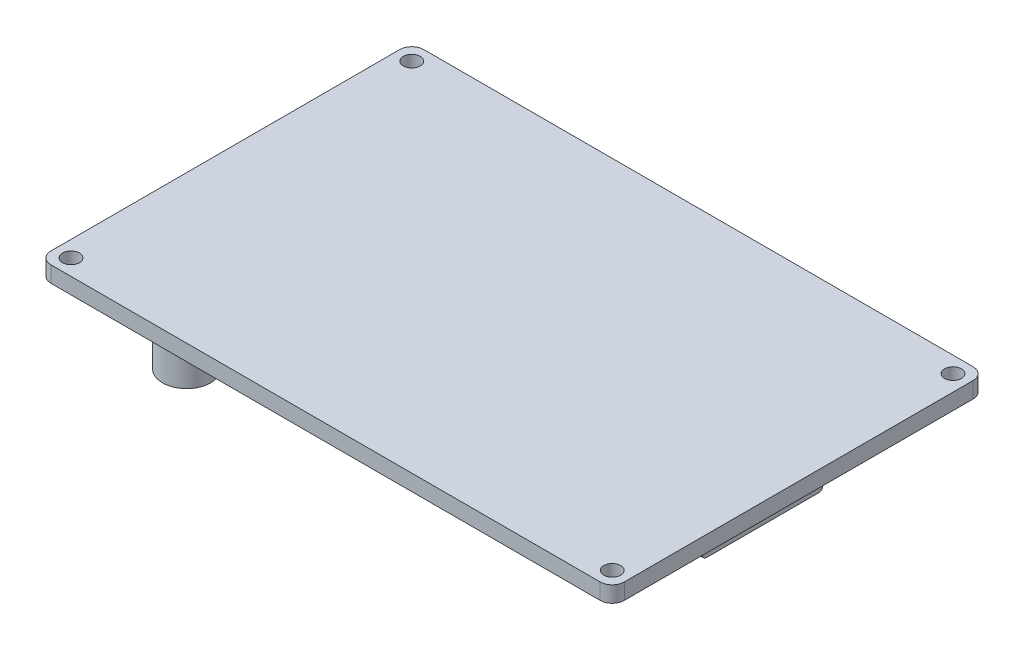
from build123d import *

# Parameters (mm, degrees)
SKETCH1_W               = 143
SKETCH1_H               = 93
LID_BASE_DEPTH          = 4
FILLET1_R               = 3
SKETCH3_W               = 136.2
SKETCH3_H               = 86.2
SKETCH3_W_2             = 127
SKETCH3_H_2             = 77
LIP_DEPTH               = 1.5
SKETCH2_R               = 2.1
SCREWS_DEPTH            = 86.467830205
LIP_FILLET_R            = 2
LIP_CHAMFER_SIZE        = 0.5
SKETCH4_W               = 5
SKETCH4_H               = 2
SKETCH4_W_2             = 2
SKETCH4_H_2             = 30
BATTERY_POCKET_DEPTH    = 14
BOTTOM_POCKET_FILLET_R  = 3
POCKET_CORNER_FILLETS_R = 1
POCKET_CHAMFER_SIZE     = 0.75
SKETCH5_R               = 6
STOMP_SUPPORT_DEPTH     = 18.85
SKETCH6_R               = 3.25
SCREW_HEAD_PLACE_DEPTH  = 4
FILLET4_R               = 1.5


with BuildPart() as part:
    # Sketch1 → lid base (new body)
    with BuildSketch(Plane(origin=(0, 0, 0), x_dir=(1, 0, 0), z_dir=(0, 1, 0))):
        Rectangle(SKETCH1_W, SKETCH1_H)
    extrude(amount=LID_BASE_DEPTH)

    # Fillet1
    fillet1_edges = [part.edges().sort_by_distance(p)[0] for p in [
        (-71.5, 2, -46.5),
        (71.5, 2, -46.5),
        (71.5, 2, 46.5),
        (-71.5, 2, 46.5),
    ]]
    fillet(fillet1_edges, radius=FILLET1_R)

    # Sketch3 → lip (add)
    with BuildSketch(Plane.XZ):
        Rectangle(SKETCH3_W, SKETCH3_H)
        Rectangle(SKETCH3_W_2, SKETCH3_H_2, mode=Mode.SUBTRACT)
    extrude(amount=LIP_DEPTH)

    # Sketch2 → screws (cut, through all)
    with BuildSketch(Plane(origin=(0, 4, 0), x_dir=(1, 0, 0), z_dir=(0, 1, 0))):
        with Locations(Location((-67.5, -42.5, 0), (0, 0, 270))):
            Circle(SKETCH2_R)
        with Locations(Location((67.5, -42.5, 0), (0, 0, 270))):
            Circle(SKETCH2_R)
        with Locations(Location((67.5, 42.5, 0), (0, 0, 270))):
            Circle(SKETCH2_R)
        with Locations(Location((-67.5, 42.5, 0), (0, 0, 270))):
            Circle(SKETCH2_R)
    extrude(amount=-SCREWS_DEPTH, mode=Mode.SUBTRACT)

    # lip fillet
    lip_fillet_edges = [part.edges().sort_by_distance(p)[0] for p in [
        (63.5, -0.75, 38.5),
        (-63.5, -0.75, 38.5),
        (-63.5, -0.75, -38.5),
        (63.5, -0.75, -38.5),
    ]]
    fillet(lip_fillet_edges, radius=LIP_FILLET_R)

    # lip chamfer
    lip_chamfer_edges = [part.edges().sort_by_distance(p)[0] for p in [
        (0, -1.5, 38.5),
        (-63.5, -1.5, 0),
        (0, -1.5, -38.5),
        (63.5, -1.5, 0),
        (-62.914213562, -1.5, 37.914213562),
        (-62.914213562, -1.5, -37.914213562),
        (62.914213562, -1.5, -37.914213562),
        (62.914213562, -1.5, 37.914213562),
        (0, -1.5, -43.1),
        (-68.1, -1.5, 0),
        (0, -1.5, 43.1),
        (68.1, -1.5, 0),
        (-65.816254176, -1.5, -41.24500996),
        (65.816254176, -1.5, -41.24500996),
        (66.01507576, -1.5, 41.01507576),
        (-66.01507576, -1.5, 41.01507576),
    ]]
    chamfer(lip_chamfer_edges, length=LIP_CHAMFER_SIZE)

    # Sketch4 → battery pocket (add)
    with BuildSketch(Plane(origin=(0, 4, 0), x_dir=(1, 0, 0), z_dir=(0, 1, 0))):
        with Locations((47, -27)):
            Rectangle(SKETCH4_W, SKETCH4_H)
        with Locations((61.5, 0)):
            Rectangle(SKETCH4_W_2, SKETCH4_H_2)
        with Locations((32.5, 0)):
            Rectangle(SKETCH4_W_2, SKETCH4_H_2)
        with Locations((47, 27)):
            Rectangle(SKETCH4_W, SKETCH4_H)
    extrude(amount=-BATTERY_POCKET_DEPTH)

    # bottom pocket fillet
    bottom_pocket_fillet_edges = [part.edges().sort_by_distance(p)[0] for p in [
        (44.5, 0, 27),
        (49.5, 0, 27),
        (61.5, 0, 15),
        (61.5, 0, -15),
        (32.5, 0, 15),
        (32.5, 0, -15),
        (49.5, 0, -27),
        (44.5, 0, -27),
    ]]
    fillet(bottom_pocket_fillet_edges, radius=BOTTOM_POCKET_FILLET_R)

    # pocket corner fillets
    pocket_corner_fillets_edges = [part.edges().sort_by_distance(p)[0] for p in [
        (49.5, -10, 27),
        (44.5, -10, 27),
        (61.5, -10, -15),
        (61.5, -10, 15),
        (32.5, -10, -15),
        (32.5, -10, 15),
        (44.5, -10, -27),
        (49.5, -10, -27),
    ]]
    fillet(pocket_corner_fillets_edges, radius=POCKET_CORNER_FILLETS_R)

    # pocket chamfer
    # the kernel refuses this chamfer: 0.75 mm, written as the material it takes off along each edge
    with BuildSketch(Plane(origin=(41.5, -3, 26), x_dir=(-0.5997422926450471, 0.8001932156753535, 0), z_dir=(-0.8001932156753535, -0.5997422926450471, 0))) as pocket_chamfer_piece_1_section:
        Polygon((3, -POCKET_CHAMFER_SIZE), (3 + POCKET_CHAMFER_SIZE, 0), (3, 0), align=None)
    pocket_chamfer_piece_1 = revolve(axis=Axis((41.5, -3, 26), (0, 0, -1)), revolution_arc=126.851442945, mode=Mode.PRIVATE)
    pocket_chamfer_piece_1 = split(pocket_chamfer_piece_1, bisect_by=Plane(origin=(43.677166172, 0, 26.274961133), z_dir=(0, -1, 0)), keep=Keep.TOP, mode=Mode.PRIVATE)
    add(pocket_chamfer_piece_1, mode=Mode.SUBTRACT)
    with BuildSketch(Plane(origin=(52.5, -3, 26), x_dir=(0.5997422926450471, 0.8001932156753535, 0), z_dir=(0.8001932156753535, -0.5997422926450471, 0))) as pocket_chamfer_piece_2_section:
        Polygon((3, POCKET_CHAMFER_SIZE), (3 + POCKET_CHAMFER_SIZE, 0), (3, 0), align=None)
    pocket_chamfer_piece_2 = revolve(axis=Axis((52.5, -3, 26), (0, 0, 1)), revolution_arc=126.851442945, mode=Mode.PRIVATE)
    pocket_chamfer_piece_2 = split(pocket_chamfer_piece_2, bisect_by=Plane(origin=(50.322833828, 0, 26.274961133), z_dir=(0, -1, 0)), keep=Keep.TOP, mode=Mode.PRIVATE)
    add(pocket_chamfer_piece_2, mode=Mode.SUBTRACT)
    with BuildSketch(Plane(origin=(60.5, -3, 18), x_dir=(0, 0.8001932156753528, 0.599742292645048), z_dir=(0, -0.599742292645048, 0.8001932156753528))) as pocket_chamfer_piece_3_section:
        Polygon((3, -POCKET_CHAMFER_SIZE), (3 + POCKET_CHAMFER_SIZE, 0), (3, 0), align=None)
    pocket_chamfer_piece_3 = revolve(axis=Axis((60.5, -3, 18), (-1, 0, 0)), revolution_arc=126.851442945, mode=Mode.PRIVATE)
    pocket_chamfer_piece_3 = split(pocket_chamfer_piece_3, bisect_by=Plane(origin=(60.774961135, 0, 15.822833887), z_dir=(0, -1, 0)), keep=Keep.TOP, mode=Mode.PRIVATE)
    add(pocket_chamfer_piece_3, mode=Mode.SUBTRACT)
    with BuildSketch(Plane(origin=(60.5, -3, -18), x_dir=(0, 0.8001932156753528, -0.599742292645048), z_dir=(0, -0.599742292645048, -0.8001932156753528))) as pocket_chamfer_piece_4_section:
        Polygon((3, POCKET_CHAMFER_SIZE), (3 + POCKET_CHAMFER_SIZE, 0), (3, 0), align=None)
    pocket_chamfer_piece_4 = revolve(axis=Axis((60.5, -3, -18), (1, 0, 0)), revolution_arc=126.851442945, mode=Mode.PRIVATE)
    pocket_chamfer_piece_4 = split(pocket_chamfer_piece_4, bisect_by=Plane(origin=(60.774961133, 0, -15.822833828), z_dir=(0, -1, 0)), keep=Keep.TOP, mode=Mode.PRIVATE)
    add(pocket_chamfer_piece_4, mode=Mode.SUBTRACT)
    with BuildSketch(Plane(origin=(52.5, -3, -26), x_dir=(0.5997422926450471, 0.8001932156753535, 2.3684757858670017e-15), z_dir=(0.8001932156753535, -0.5997422926450471, 2.8428573830131827e-15))) as pocket_chamfer_piece_5_section:
        Polygon((3, -POCKET_CHAMFER_SIZE), (3 + POCKET_CHAMFER_SIZE, 0), (3, 0), align=None)
    pocket_chamfer_piece_5 = revolve(axis=Axis((52.5, -3, -26), (0, 0, 1)), revolution_arc=126.851442945, mode=Mode.PRIVATE)
    pocket_chamfer_piece_5 = split(pocket_chamfer_piece_5, bisect_by=Plane(origin=(50.322833828, 0, -26.274961133), z_dir=(0, -1, 0)), keep=Keep.TOP, mode=Mode.PRIVATE)
    add(pocket_chamfer_piece_5, mode=Mode.SUBTRACT)
    with BuildSketch(Plane(origin=(41.5, -3, -26), x_dir=(-0.5997422926450493, 0.8001932156753517, -2.368475785867001e-15), z_dir=(-0.8001932156753517, -0.5997422926450493, -2.8428573830131665e-15))) as pocket_chamfer_piece_6_section:
        Polygon((3 + POCKET_CHAMFER_SIZE, 0), (3, POCKET_CHAMFER_SIZE), (3, 0), align=None)
    pocket_chamfer_piece_6 = revolve(axis=Axis((41.5, -3, -26), (0, 0, -1)), revolution_arc=126.851442945, mode=Mode.PRIVATE)
    pocket_chamfer_piece_6 = split(pocket_chamfer_piece_6, bisect_by=Plane(origin=(43.677165597, 0, -26.274960992), z_dir=(0, -1, 0)), keep=Keep.TOP, mode=Mode.PRIVATE)
    add(pocket_chamfer_piece_6, mode=Mode.SUBTRACT)
    with BuildSketch(Plane(origin=(33.5, -3, -18), x_dir=(0, 0.8001932156753535, -0.5997422926450471), z_dir=(0, -0.5997422926450471, -0.8001932156753535))) as pocket_chamfer_piece_7_section:
        Polygon((3 + POCKET_CHAMFER_SIZE, 0), (3, -POCKET_CHAMFER_SIZE), (3, 0), align=None)
    pocket_chamfer_piece_7 = revolve(axis=Axis((33.5, -3, -18), (1, 0, 0)), revolution_arc=126.851442945, mode=Mode.PRIVATE)
    pocket_chamfer_piece_7 = split(pocket_chamfer_piece_7, bisect_by=Plane(origin=(33.225038867, 0, -15.822833828), z_dir=(0, -1, 0)), keep=Keep.TOP, mode=Mode.PRIVATE)
    add(pocket_chamfer_piece_7, mode=Mode.SUBTRACT)
    with BuildSketch(Plane(origin=(33.5, -3, 18), x_dir=(0, 0.8001932156753535, 0.5997422926450471), z_dir=(0, -0.5997422926450471, 0.8001932156753535))) as pocket_chamfer_piece_8_section:
        Polygon((3 + POCKET_CHAMFER_SIZE, 0), (3, POCKET_CHAMFER_SIZE), (3, 0), align=None)
    pocket_chamfer_piece_8 = revolve(axis=Axis((33.5, -3, 18), (-1, 0, 0)), revolution_arc=126.851442945, mode=Mode.PRIVATE)
    pocket_chamfer_piece_8 = split(pocket_chamfer_piece_8, bisect_by=Plane(origin=(33.225038867, 0, 15.822833828), z_dir=(0, -1, 0)), keep=Keep.TOP, mode=Mode.PRIVATE)
    add(pocket_chamfer_piece_8, mode=Mode.SUBTRACT)
    with BuildSketch(Plane(origin=(60.5, -3, -15), x_dir=(-0.027495876610582164, 0, 0.9996219169112969), z_dir=(0, -1, 0)), Plane(origin=(49.5, -3, 26), x_dir=(-0.9996219169112968, 0, -0.027495876610586893), z_dir=(0, -1, 0)), Plane(origin=(33.5, -3, 15), x_dir=(0.027495876610582164, 0, -0.9996219169112969), z_dir=(0, -1, 0)), Plane(origin=(44.5, -3, -26), x_dir=(0.9996219169112968, 0, 0.027495876610586893), z_dir=(0, -1, 0)), Plane(origin=(49.5, -3, -26), x_dir=(0.027495876610582164, 0, -0.9996219169112969), z_dir=(0, -1, 0))) as pocket_chamfer_piece_9:
        Polygon((POCKET_CHAMFER_SIZE * 0.999621916911, -POCKET_CHAMFER_SIZE * 0.0274958766106), (-POCKET_CHAMFER_SIZE * 0.0274958766106, -POCKET_CHAMFER_SIZE * 0.999621916911), (0, 0), align=None)
    extrude(amount=6, mode=Mode.SUBTRACT)
    with BuildSketch(Plane(origin=(60.5, -10, 14), x_dir=(-0.027495876610582164, 0.9996219169112969, 0), z_dir=(0, 0, -1))) as pocket_chamfer_piece_10:
        Polygon((POCKET_CHAMFER_SIZE * 0.999621916911, POCKET_CHAMFER_SIZE * 0.0274958766106), (-POCKET_CHAMFER_SIZE * 0.0274958766106, POCKET_CHAMFER_SIZE * 0.999621916911), (0, 0), align=None)
    extrude(amount=28, mode=Mode.SUBTRACT)
    with BuildSketch(Plane(origin=(60.5, -3, 15), x_dir=(-0.027495876610582164, 0, -0.9996219169112969), z_dir=(0, -1, 0)), Plane(origin=(44.5, -3, 26), x_dir=(0.9996219169112968, 0, -0.027495876610586893), z_dir=(0, -1, 0)), Plane(origin=(33.5, -3, -15), x_dir=(0.027495876610582164, 0, 0.9996219169112969), z_dir=(0, -1, 0))) as pocket_chamfer_piece_11:
        Polygon((POCKET_CHAMFER_SIZE * 0.999621916911, POCKET_CHAMFER_SIZE * 0.0274958766106), (-POCKET_CHAMFER_SIZE * 0.0274958766106, POCKET_CHAMFER_SIZE * 0.999621916911), (0, 0), align=None)
    extrude(amount=6, mode=Mode.SUBTRACT)
    with BuildSketch(Plane(origin=(60.5, -9, 14), x_dir=(0, -1, 0), z_dir=(0, 0, -1))) as pocket_chamfer_piece_12:
        Polygon((1 - POCKET_CHAMFER_SIZE, 0), (1, -POCKET_CHAMFER_SIZE), (1, 0), align=None)
    revolve(axis=Axis((60.5, -9, 14), (-1, 0, 0)), revolution_arc=90, mode=Mode.SUBTRACT)
    with BuildSketch(Plane(origin=(60.5, -9, -14), x_dir=(0, -1, 0), z_dir=(0, 0, 1))) as pocket_chamfer_piece_13:
        Polygon((1 - POCKET_CHAMFER_SIZE, 0), (1, POCKET_CHAMFER_SIZE), (1, 0), align=None)
    revolve(axis=Axis((60.5, -9, -14), (1, 0, 0)), revolution_arc=90, mode=Mode.SUBTRACT)
    with BuildSketch(Plane(origin=(45.5, -10, 26), x_dir=(0, 0.9996219169112965, -0.02749587661058676), z_dir=(1, 0, 0))) as pocket_chamfer_piece_14:
        Polygon((POCKET_CHAMFER_SIZE * 0.999621916911, POCKET_CHAMFER_SIZE * 0.0274958766106), (-POCKET_CHAMFER_SIZE * 0.0274958766106, POCKET_CHAMFER_SIZE * 0.999621916911), (0, 0), align=None)
    extrude(amount=3, mode=Mode.SUBTRACT)
    with BuildSketch(Plane(origin=(45.5, -9, 26), x_dir=(0, -1, 0), z_dir=(1, 0, 0))) as pocket_chamfer_piece_15:
        Polygon((1 - POCKET_CHAMFER_SIZE, 0), (1, -POCKET_CHAMFER_SIZE), (1, 0), align=None)
    revolve(axis=Axis((45.5, -9, 26), (0, 0, -1)), revolution_arc=90, mode=Mode.SUBTRACT)
    with BuildSketch(Plane(origin=(48.5, -9, 26), x_dir=(0, -1, 0), z_dir=(-1, 0, 0))) as pocket_chamfer_piece_16:
        Polygon((1 - POCKET_CHAMFER_SIZE, 0), (1, POCKET_CHAMFER_SIZE), (1, 0), align=None)
    revolve(axis=Axis((48.5, -9, 26), (0, 0, 1)), revolution_arc=90, mode=Mode.SUBTRACT)
    with BuildSketch(Plane(origin=(33.5, -10, 14), x_dir=(0.027495876610582164, 0.9996219169112969, 0), z_dir=(0, 0, -1))) as pocket_chamfer_piece_17:
        Polygon((POCKET_CHAMFER_SIZE * 0.999621916911, -POCKET_CHAMFER_SIZE * 0.0274958766106), (-POCKET_CHAMFER_SIZE * 0.0274958766106, -POCKET_CHAMFER_SIZE * 0.999621916911), (0, 0), align=None)
    extrude(amount=28, mode=Mode.SUBTRACT)
    with BuildSketch(Plane(origin=(33.5, -9, -14), x_dir=(0, -1, 0), z_dir=(0, 0, 1))) as pocket_chamfer_piece_18:
        Polygon((1 - POCKET_CHAMFER_SIZE, 0), (1, -POCKET_CHAMFER_SIZE), (1, 0), align=None)
    revolve(axis=Axis((33.5, -9, -14), (1, 0, 0)), revolution_arc=90, mode=Mode.SUBTRACT)
    with BuildSketch(Plane(origin=(33.5, -9, 14), x_dir=(0, 0, 1), z_dir=(0, 1, 0))) as pocket_chamfer_piece_19:
        Polygon((1 - POCKET_CHAMFER_SIZE, 0), (1, -POCKET_CHAMFER_SIZE), (1, 0), align=None)
    revolve(axis=Axis((33.5, -9, 14), (1, 0, 0)), revolution_arc=90, mode=Mode.SUBTRACT)
    with BuildSketch(Plane(origin=(45.5, -10, -26), x_dir=(0, 0.9996219169112965, 0.02749587661058676), z_dir=(1, 0, 0))) as pocket_chamfer_piece_20:
        Polygon((POCKET_CHAMFER_SIZE * 0.999621916911, -POCKET_CHAMFER_SIZE * 0.0274958766106), (-POCKET_CHAMFER_SIZE * 0.0274958766106, -POCKET_CHAMFER_SIZE * 0.999621916911), (0, 0), align=None)
    extrude(amount=3, mode=Mode.SUBTRACT)
    with BuildSketch(Plane(origin=(48.5, -9, -26), x_dir=(1, 0, 0), z_dir=(0, 1, 0))) as pocket_chamfer_piece_21:
        Polygon((1, POCKET_CHAMFER_SIZE), (1 - POCKET_CHAMFER_SIZE, 0), (1, 0), align=None)
    revolve(axis=Axis((48.5, -9, -26), (0, 0, -1)), revolution_arc=90, mode=Mode.SUBTRACT)
    with BuildSketch(Plane(origin=(45.5, -9, -26), x_dir=(0, -1, 0), z_dir=(1, 0, 0))) as pocket_chamfer_piece_22:
        Polygon((1 - POCKET_CHAMFER_SIZE, 0), (1, POCKET_CHAMFER_SIZE), (1, 0), align=None)
    revolve(axis=Axis((45.5, -9, -26), (0, 0, -1)), revolution_arc=90, mode=Mode.SUBTRACT)

    # Sketch5 → stomp support (add)
    with BuildSketch(Plane(origin=(0, 0, 0), x_dir=(-1, 0, 0), z_dir=(0, -1, 0))):
        with Locations(Location((51.91841541, -29.239997644, 0), (0, 0, 270))):
            Circle(SKETCH5_R)
        with Locations(Location((51.91841541, 29.760001196, 0), (0, 0, 270))):
            Circle(SKETCH5_R)
    extrude(amount=STOMP_SUPPORT_DEPTH)

    # Sketch6 → screw head place (cut)
    with BuildSketch(Plane(origin=(0, -18.85, 0), x_dir=(-1, 0, 0), z_dir=(0, -1, 0))):
        with Locations(Location((51.91841541, -29.239997644, 0), (0, 0, 90))):
            Circle(SKETCH6_R)
        with Locations(Location((51.91841541, 29.760001196, 0), (0, 0, 90))):
            Circle(SKETCH6_R)
    extrude(amount=-SCREW_HEAD_PLACE_DEPTH, mode=Mode.SUBTRACT)

    # Fillet4
    fillet4_edges = [part.edges().sort_by_distance(p)[0] for p in [
        (-51.91841541, 0, 23.239997644),
        (-51.91841541, 0, -35.760001196),
    ]]
    fillet(fillet4_edges, radius=FILLET4_R)


solid = part.part
